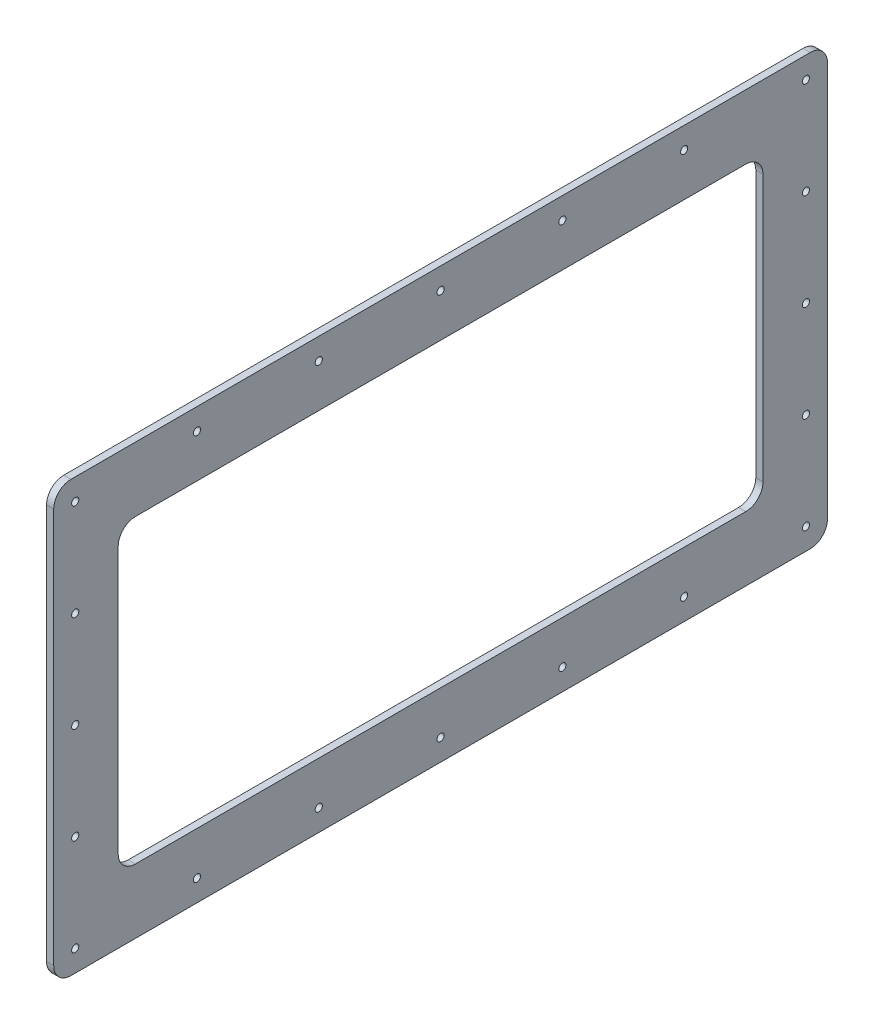
from build123d import *

# Parameters (mm, degrees)
BOSS_EXTRUDE1_START         = 12.7
SKETCH1_W                   = 685.8
SKETCH1_H                   = 381
SKETCH1_W_2                 = 571.5
SKETCH1_H_2                 = 266.7
BOSS_EXTRUDE1_DEPTH         = 6.35
F_1_4_0_25_DIAMETER_HOLE1_D = 6.35
LPATTERN2_COUNT             = 7
LPATTERN2_PITCH             = 107.95
LPATTERN2_COUNT_DIR2        = 5
LPATTERN2_PITCH_DIR2        = 85.725
FILLET1_R                   = 15.24


with BuildPart() as part:
    # Sketch1 → Boss-Extrude1 (new body)
    with BuildSketch(Plane.ZY.offset(311.15).offset(BOSS_EXTRUDE1_START)):
        with Locations((0, 330.2)):
            Rectangle(SKETCH1_W, SKETCH1_H)
        with Locations((0, 330.2)):
            Rectangle(SKETCH1_W_2, SKETCH1_H_2, mode=Mode.SUBTRACT)
    extrude(amount=BOSS_EXTRUDE1_DEPTH)

    # 1/4 (0.25) Diameter Hole1 (through all)
    with Locations(Plane.ZY.offset(330.2)):
        with Locations((-323.85, 158.75)):
            f_1_4_0_25_diameter_hole1 = Hole(F_1_4_0_25_DIAMETER_HOLE1_D / 2)

    # LPattern2: 1_4 _0.25_ Diameter Hole1 7 × 5, 15 skipped
    with Locations(*[(0, j * LPATTERN2_PITCH_DIR2, i * LPATTERN2_PITCH) for i in range(LPATTERN2_COUNT) for j in range(LPATTERN2_COUNT_DIR2) if (i, j) not in ((0, 0), (1, 1), (1, 2), (1, 3), (2, 1), (2, 2), (2, 3), (3, 1), (3, 2), (3, 3), (4, 1), (4, 2), (4, 3), (5, 1), (5, 2), (5, 3))]):
        add(f_1_4_0_25_diameter_hole1, mode=Mode.SUBTRACT)

    # Fillet1
    fillet1_edges = [part.edges().sort_by_distance(p)[0] for p in [
        (-327.025, 196.85, 285.75),
        (-327.025, 463.55, 285.75),
        (-327.025, 196.85, -285.75),
        (-327.025, 139.7, 342.9),
        (-327.025, 139.7, -342.9),
        (-327.025, 520.7, 342.9),
        (-327.025, 463.55, -285.75),
        (-327.025, 520.7, -342.9),
    ]]
    fillet(fillet1_edges, radius=FILLET1_R)


solid = part.part
